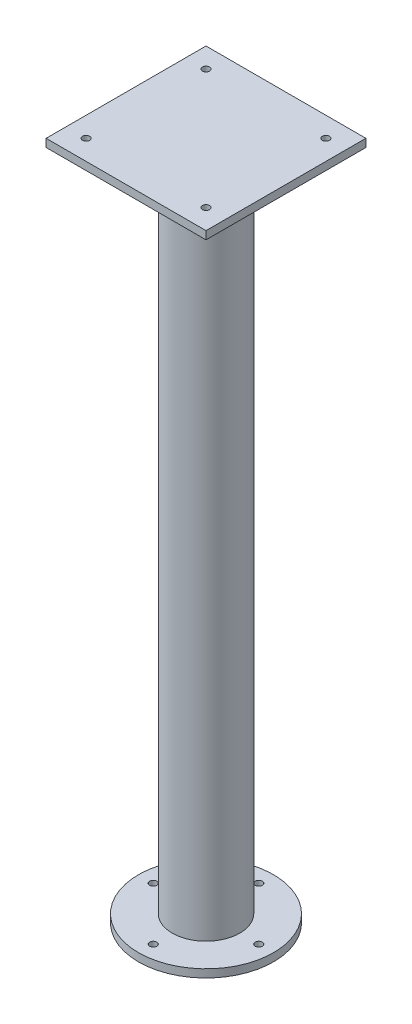
from build123d import *

# Parameters (mm, degrees)
SKETCH1_R           = 84.5
SKETCH1_R_2         = 4.5
BOSS_EXTRUDE4_DEPTH = 10
SKETCH2_R           = 42.25
BOSS_EXTRUDE5_DEPTH = 830
SKETCH4_W           = 200
SKETCH4_H           = 200
BOSS_EXTRUDE6_DEPTH = 10
SKETCH5_R           = 4.5
CUT_EXTRUDE1_DEPTH  = 862.684396981


with BuildPart() as part:
    # Sketch1 → Boss-Extrude4 (new body)
    with BuildSketch(Plane(origin=(0, 0, 0), x_dir=(1, 0, 0), z_dir=(0, 1, 0))):
        Circle(SKETCH1_R)
        with Locations((0, -66)):
            Circle(SKETCH1_R_2, mode=Mode.SUBTRACT)
        with Locations((66, 0)):
            Circle(SKETCH1_R_2, mode=Mode.SUBTRACT)
        with Locations((-66, 0)):
            Circle(SKETCH1_R_2, mode=Mode.SUBTRACT)
        with Locations((0, 66)):
            Circle(SKETCH1_R_2, mode=Mode.SUBTRACT)
    extrude(amount=BOSS_EXTRUDE4_DEPTH)

    # Sketch2 → Boss-Extrude5 (add)
    with BuildSketch(Plane(origin=(0, 10, 0), x_dir=(1, 0, 0), z_dir=(0, 1, 0))):
        Circle(SKETCH2_R)
    extrude(amount=BOSS_EXTRUDE5_DEPTH)

    # Sketch4 → Boss-Extrude6 (add)
    with BuildSketch(Plane(origin=(0, 840, 0), x_dir=(1, 0, 0), z_dir=(0, 1, 0))):
        Rectangle(SKETCH4_W, SKETCH4_H)
    extrude(amount=BOSS_EXTRUDE6_DEPTH)

    # Sketch5 → Cut-Extrude1 (cut, through all)
    with BuildSketch(Plane(origin=(0, 850, 0), x_dir=(1, 0, 0), z_dir=(0, 1, 0))):
        with Locations((-75, -75)):
            Circle(SKETCH5_R)
        with Locations((75, -75)):
            Circle(SKETCH5_R)
        with Locations((-75, 75)):
            Circle(SKETCH5_R)
        with Locations((75, 75)):
            Circle(SKETCH5_R)
    extrude(amount=-CUT_EXTRUDE1_DEPTH, mode=Mode.SUBTRACT)


solid = part.part
